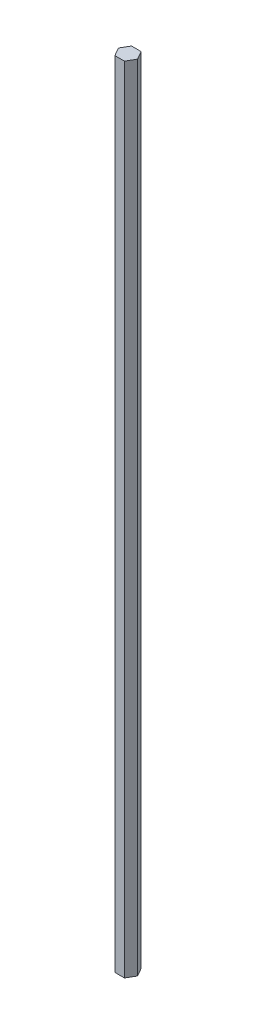
from build123d import *

# Parameters (mm, degrees)
BOSS_EXTRUDE1_DEPTH = 303.276


with BuildPart() as part:
    # Sketch1 → Boss-Extrude1 (new, symmetric)
    with BuildSketch(Plane(origin=(0, 0, 0), x_dir=(1, 0, 0), z_dir=(0, 1, 0))):
        Polygon((7.332348419, 0), (3.666174209, 6.35), (-3.666174209, 6.35), (-7.332348419, 0), (-3.666174209, -6.35), (3.666174209, -6.35), align=None)
    extrude(amount=BOSS_EXTRUDE1_DEPTH, both=True)


solid = part.part
